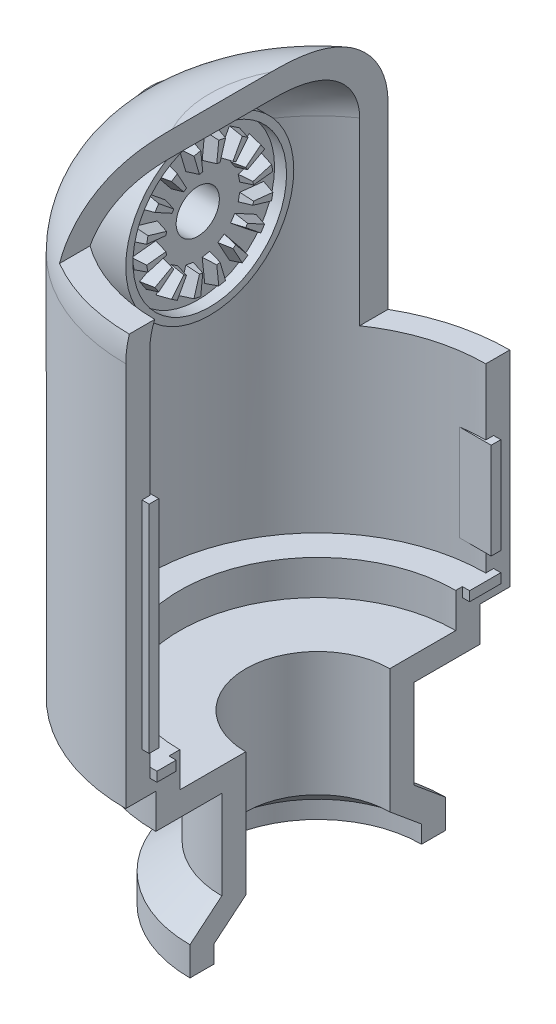
from build123d import *

# Parameters (mm, degrees)
SKETCH_1_R               = 16
EXTRUDE_1_DEPTH          = 54
FILLET_1_R               = 7
SHELL_1_T                = -2
CUT_EXTRUDE_1_DEPTH      = 59.549124673
CUT_EXTRUDE_1_DEPTH_BACK = 59.549124673
SKETCH_3_W               = 17.994708596
SKETCH_3_H               = 55.587571792
SKETCH_4_W               = 8
SKETCH_4_H               = 33.452685978
CUT_EXTRUDE_3_DEPTH      = 5
SKETCH_5_W               = 8
SKETCH_5_H               = 16.394935261
CUT_EXTRUDE_4_DEPTH      = 22
EXTRUDE_2_REACH          = 59.035
EXTRUDE_2_END_RADIUS     = 14
SKETCH_6_R               = 7
SKETCH_7_R               = 1.8
CUT_EXTRUDE_5_DEPTH      = 58.035077065
SKETCH_8_R               = 6.4
CUT_EXTRUDE_6_DEPTH      = 1
EXTRUDE_3_DEPTH          = 1
EXTRUDE_3_TAPER          = 11
PATTERN_CIRCULAR_1_COUNT = 16
EXTRUDE_4_DEPTH          = 0.6
EXTRUDE_4_DEPTH_BACK     = 6
SKETCH_10_W              = 0.8
SKETCH_10_H              = 18
SKETCH_10_W_2            = 1.6
SKETCH_10_H_2            = 0.8
SKETCH_10_W_3            = 2.6
SKETCH_10_H_3            = 8


with BuildPart() as part:
    # 스케치1 → 보스-돌출1 (new body)
    with BuildSketch(Plane(origin=(0, 0, 0), x_dir=(1, 0, 0), z_dir=(0, 1, 0))):
        with Locations(Location((0, 0, 0), (0, 0, 270))):
            Circle(SKETCH_1_R)
    extrude(amount=EXTRUDE_1_DEPTH)

    # 스케치2 → 컷-회전1 (revolve, cut)
    with BuildSketch(Plane.XY, mode=Mode.PRIVATE) as cut_revolve_1_sk:
        Polygon((19.244798042, 14.9), (13.5, 14.9), (13.5, 12), (8, 12), (8, 4.6), (10.65, 2.4), (10.65, 0), (19.244798042, 0), align=None)
    revolve(cut_revolve_1_sk.sketch.rotate(Axis((0, 0, 0), (0, 1, 0)), 90), axis=Axis((0, 0, 0), (0, 1, 0)), mode=Mode.SUBTRACT)

    # 필렛1
    fillet_1_edges = [part.edges().sort_by_distance(p)[0] for p in [
        (0, 54, -16),
    ]]
    fillet(fillet_1_edges, radius=FILLET_1_R)

    # 쉘1
    shell_1_openings = [part.faces().sort_by_distance(p)[0] for p in [
        (0, 0, 0),
    ]]
    offset(amount=SHELL_1_T, openings=shell_1_openings, kind=Kind.INTERSECTION)

    # 스케치3 → 컷-돌출1 (cut, two sides: drawn at the far end of the back side and taken through both)
    with BuildSketch(Plane.XY.offset(-CUT_EXTRUDE_1_DEPTH_BACK)):
        with Locations((8.997354298, 27.793785896)):
            Rectangle(SKETCH_3_W, SKETCH_3_H)
    extrude(amount=CUT_EXTRUDE_1_DEPTH + CUT_EXTRUDE_1_DEPTH_BACK, mode=Mode.SUBTRACT)

    # 스케치4 → 컷-돌출3 (cut)
    with BuildSketch(Plane(origin=(0, 54, 0), x_dir=(1, 0, 0), z_dir=(0, 1, 0))):
        with Locations((-4, -0.253429439)):
            Rectangle(SKETCH_4_W, SKETCH_4_H)
    extrude(amount=-CUT_EXTRUDE_3_DEPTH, mode=Mode.SUBTRACT)

    # 스케치5 → 컷-돌출4 (cut)
    with BuildSketch(Plane(origin=(0, 54, 0), x_dir=(1, 0, 0), z_dir=(0, 1, 0))):
        with Locations((-4, 8.197467631)):
            Rectangle(SKETCH_5_W, SKETCH_5_H)
    extrude(amount=-CUT_EXTRUDE_4_DEPTH, mode=Mode.SUBTRACT)

    # 보스-돌출2: up to this cylinder (the profile starts inside it)
    extrude_2_end = Plane(origin=(0, 45, 0), z_dir=(0, -1, 0)) * Cylinder(EXTRUDE_2_END_RADIUS, 147.07, mode=Mode.PRIVATE)
    # 스케치6 → 보스-돌출2 (add, up to the surface)
    with BuildSketch(Plane(origin=(-9, 0, 0), x_dir=(0, 0, -1), z_dir=(1, 0, 0)), mode=Mode.PRIVATE) as extrude_2_sk1:
        with Locations((0, 45)):
            Circle(SKETCH_6_R)
    extrude_2_tool1 = extrude(extrude_2_sk1.sketch, amount=-EXTRUDE_2_REACH, mode=Mode.PRIVATE) & extrude_2_end
    add(extrude_2_tool1.solids().sort_by_distance((-9, 45, 0))[0])

    # 스케치7 → 컷-돌출5 (cut, through all)
    with BuildSketch(Plane(origin=(-9, 0, 0), x_dir=(0, 0, -1), z_dir=(1, 0, 0))):
        with Locations((0, 45)):
            Circle(SKETCH_7_R)
    extrude(amount=-CUT_EXTRUDE_5_DEPTH, mode=Mode.SUBTRACT)

    # 스케치8 → 컷-돌출6 (cut)
    with BuildSketch(Plane(origin=(-9, 0, 0), x_dir=(0, 0, -1), z_dir=(1, 0, 0))):
        with Locations((0, 45)):
            Circle(SKETCH_8_R)
    extrude(amount=-CUT_EXTRUDE_6_DEPTH, mode=Mode.SUBTRACT)

    # 스케치9 → 보스-돌출3 (add)
    with BuildSketch(Plane(origin=(-10, 0, 0), x_dir=(0, 0, -1), z_dir=(1, 0, 0))):
        Polygon((0.370748083, 48.494822675), (0.994884171, 48.370674288), (1.563389411, 50.296773881), (0.582604131, 50.491864203), align=None)
    extrude_3 = extrude(amount=EXTRUDE_3_DEPTH, taper=EXTRUDE_3_TAPER)

    # 원형 패턴1: 보스-돌출3 ×16 about axis
    pattern_circular_1_axis = Axis((0, 45, 0), (1, 0, 0))
    for i in range(1, PATTERN_CIRCULAR_1_COUNT):
        add(extrude_3.rotate(pattern_circular_1_axis, i * 360 / PATTERN_CIRCULAR_1_COUNT))

    # 스케치10 → 보스-돌출4 (add, two sides: drawn at the far end of the back side and taken through both)
    with BuildSketch(Plane(origin=(0, 0, 0), x_dir=(0, 0, -1), z_dir=(1, 0, 0)).offset(-EXTRUDE_4_DEPTH_BACK)):
        with Locations((-14.25, 27.5)):
            Rectangle(SKETCH_10_W, SKETCH_10_H)
        with Locations((-13.2, 16.5)):
            Rectangle(SKETCH_10_W_2, SKETCH_10_H_2)
        with Locations((13.35, 16.5)):
            Rectangle(SKETCH_10_W_3, SKETCH_10_H_2)
        with Locations((14.25, 22.5)):
            Rectangle(SKETCH_10_W, SKETCH_10_H_3)
    extrude(amount=EXTRUDE_4_DEPTH + EXTRUDE_4_DEPTH_BACK)


solid = part.part
